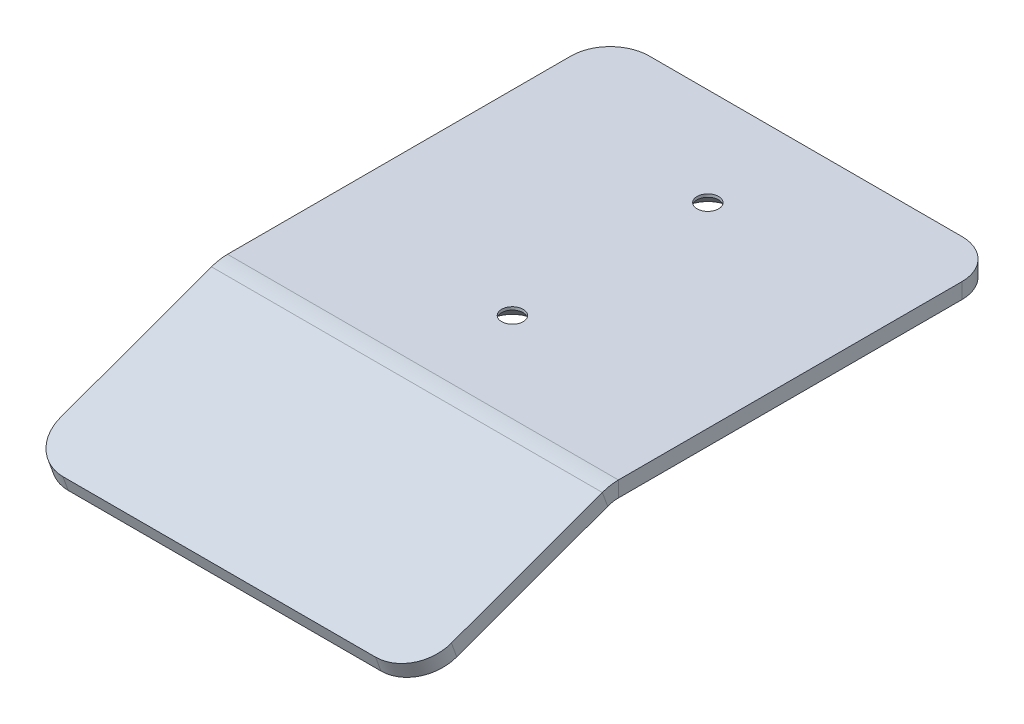
from build123d import *

# Parameters (mm, degrees)
BASE_FLANGE1_START                           = -50
BASE_FLANGE1_DEPTH                           = 100
CSK_FOR_M5_COUNTERSUNK_FLAT_HEAD_SCR_2_COUNT = 2
CSK_FOR_M5_COUNTERSUNK_FLAT_HEAD_SCR_2_PITCH = 50
FILLET1_R                                    = 10


# Read off the part's stored shape, not the designer's step: Base-Flange1
with BuildPart() as part:
    # Base-Flange1 outline → Base-Flange1 (new body)
    with BuildSketch(Plane(origin=(0, 0, 0), x_dir=(0, 0, -1), z_dir=(1, 0, 0)).offset(BASE_FLANGE1_START)):
        with BuildLine():
            Line((-47.884076231, -4), (50, -4))
            Line((50, -4), (50, 0))
            Line((50, 0), (-47.884076231, 0))
            ThreePointArc((-47.884076231, 0), (-49.967854363, -0.182306964), (-51.988317951, -0.723688551))
            Line((-51.988317951, -0.723688551), (-100, -18.198511713))
            Line((-100, -18.198511713), (-98.631919427, -21.957282196))
            Line((-98.631919427, -21.957282196), (-50.620237378, -4.482459034))
            ThreePointArc((-50.620237378, -4.482459034), (-49.273261653, -4.121537976), (-47.884076231, -4))
        make_face()
    extrude(amount=BASE_FLANGE1_DEPTH)

    # Sketch8 → CSK for M5 Countersunk Flat Head Screw1 (revolve, cut)
    with BuildSketch(Plane(origin=(0, -4, 25), x_dir=(0, 0, -1), z_dir=(1, 0, 0))):
        Polygon((0, 0), (0, 4), (2.75, 4), (2.75, 3.25), (6, 0), align=None)
    csk_for_m5_countersunk_flat_head_screw1 = revolve(axis=Axis((0, -10.35, 25), (0, 1, 0)), mode=Mode.SUBTRACT)

    # CSK for M5 Countersunk Flat Head Scr 2: CSK for M5 Countersunk Flat Head Screw1 ×2
    with Locations(*[(0, 0, -i * CSK_FOR_M5_COUNTERSUNK_FLAT_HEAD_SCR_2_PITCH) for i in range(1, CSK_FOR_M5_COUNTERSUNK_FLAT_HEAD_SCR_2_COUNT)]):
        add(csk_for_m5_countersunk_flat_head_screw1, mode=Mode.SUBTRACT)

    # Fillet1
    fillet1_edges = [part.edges().sort_by_distance(p)[0] for p in [
        (50, -20.077896954, 99.315959714),
        (50, -2, -50),
        (-50, -20.077896954, 99.315959714),
        (-50, -2, -50),
    ]]
    fillet(fillet1_edges, radius=FILLET1_R)


solid = part.part
